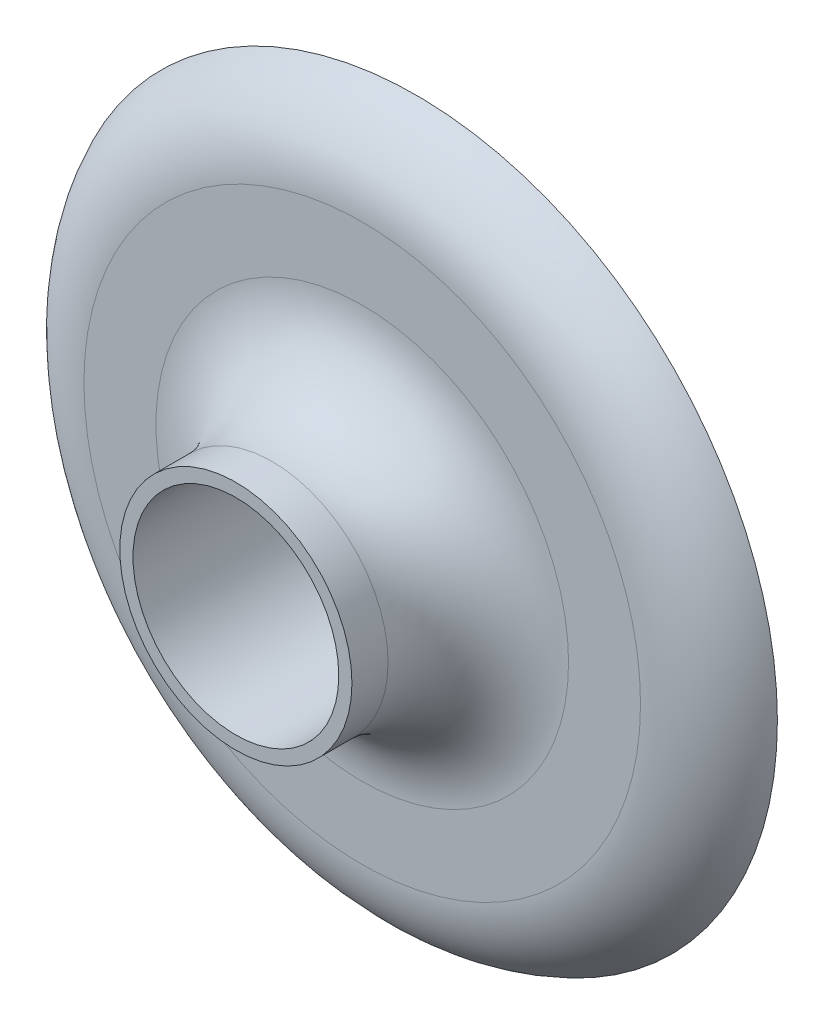
from build123d import *

# Parameters (mm, degrees)
SKETCH1_R           = 50.8
BOSS_EXTRUDE1_DEPTH = 25.4
SKETCH2_R           = 14.478
CUT_EXTRUDE1_DEPTH  = 25.4
SKETCH3_OUTSIDE_W   = 132.782
SKETCH3_OUTSIDE_H   = 132.782
SKETCH3_OUTSIDE_R   = 16.333066569
CUT_EXTRUDE2_DEPTH  = 17.78
FILLET1_R           = 12.7
FILLET2_R           = 12.7


with BuildPart() as part:
    # Sketch1 → Boss-Extrude1 (new body)
    with BuildSketch(Plane.XY):
        with Locations((-23.323029636, 24.13527445)):
            Circle(SKETCH1_R)
    extrude(amount=BOSS_EXTRUDE1_DEPTH)

    # Sketch2 → Cut-Extrude1 (cut)
    with BuildSketch(Plane.XY.offset(25.4)):
        with Locations((-23.323029636, 24.13527445)):
            Circle(SKETCH2_R)
    extrude(amount=-CUT_EXTRUDE1_DEPTH, mode=Mode.SUBTRACT)

    # Sketch3 outside → Cut-Extrude2 (cut)
    with BuildSketch(Plane.XY.offset(25.4)):
        with Locations((-23.323, 24.135)):
            Rectangle(SKETCH3_OUTSIDE_W, SKETCH3_OUTSIDE_H)
        with Locations((-23.323029636, 24.13527445)):
            Circle(SKETCH3_OUTSIDE_R, mode=Mode.SUBTRACT)
    extrude(amount=-CUT_EXTRUDE2_DEPTH, mode=Mode.SUBTRACT)

    # Fillet1
    fillet1_edges = [part.edges().sort_by_distance(p)[0] for p in [
        (-39.656096206, 24.13527445, 7.62),
    ]]
    fillet(fillet1_edges, radius=FILLET1_R)

    # Fillet2
    # the kernel refuses this fillet: 12.7 mm, written as the material it takes off along each edge
    with BuildSketch(Plane(origin=(-23.323029636, 24.13527445, 7.62), x_dir=(1, 0, 0), z_dir=(0, 1, 0))) as fillet2_piece_1:
        with BuildLine():
            CenterArc((39.160257735, 12.7), FILLET2_R, 270, 66.421821522)
            Line((50.8, 7.62), (51.032794845, 7.5184))
            ThreePointArc((51.032794845, 7.5184), (51.054, 3.81), (51.054, 0))
            Line((51.054, 0), (50.8, -0.254))
            Line((50.8, -0.254), (39.160257735, -0.254))
            Line((39.160257735, -0.254), (39.160257735, 0))
        make_face()
    revolve(axis=Axis((-23.323029636, 24.13527445, 7.62), (0, 0, -1)), mode=Mode.SUBTRACT)


solid = part.part
